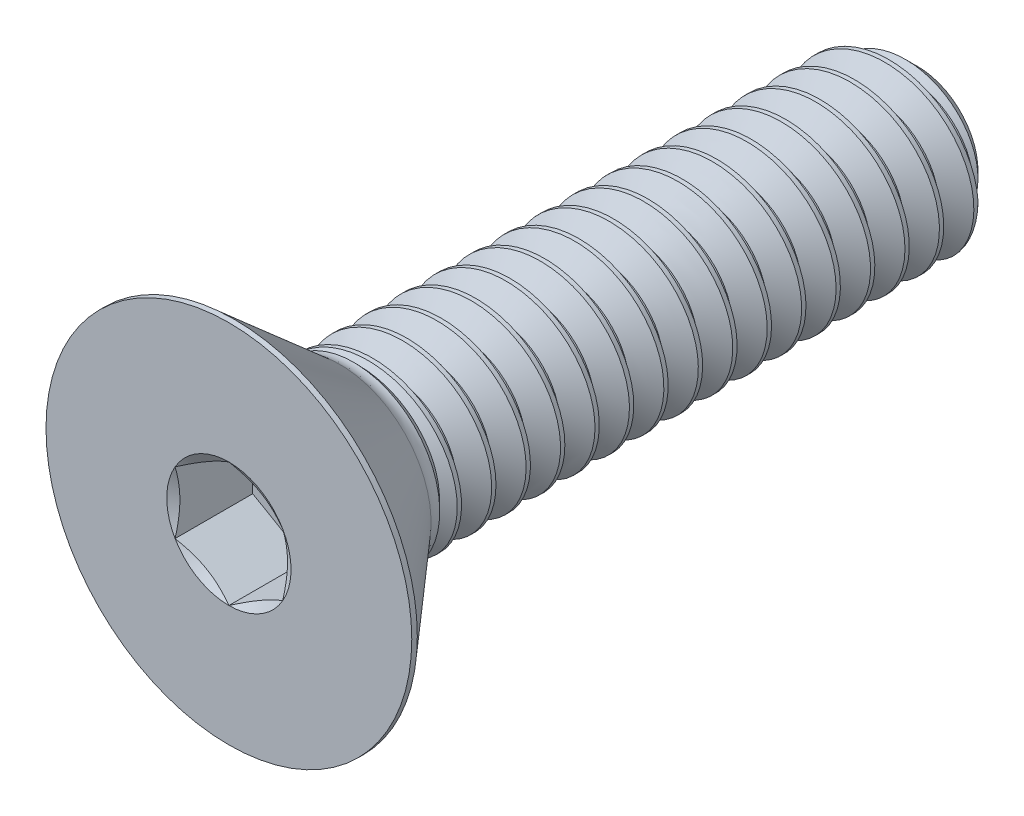
from build123d import *

# Parameters (mm, degrees)
SKETCH1_W          = 25.4
SKETCH1_H          = 3.175
CHAMFER1_SIZE      = 0.9525
CUT_SWEEP1_PITCH   = 1.27
CUT_EXTRUDE2_DEPTH = 2.86258


with BuildPart() as part:
    # Sketch1 → Revolve1 (revolve)
    with BuildSketch(Plane(origin=(0, 0, 0), x_dir=(0, 0, -1), z_dir=(1, 0, 0))):
        with Locations((12.7, 1.5875)):
            Rectangle(SKETCH1_W, SKETCH1_H)
    revolve(axis=Axis((0, 0, -25.4), (0, 0, 1)))

    # Chamfer1
    chamfer1_edges = [part.edges().sort_by_distance(p)[0] for p in [
        (0, -3.175, -25.4),
    ]]
    chamfer(chamfer1_edges, length=CHAMFER1_SIZE)

    # Cut-Sweep1: the profile of Sketch2 profile screwed along a right-hand helix of 20 turns, 8 arcs to a turn; built about Z, then put on its axis
    cut_sweep1_z = Axis((0, 0, 0), (0, 0, 1))
    cut_sweep1_corners = [(3.1756, 0, 0.00034641), (3.1756, 0, -1.11159641), (2.350110803, 0, -0.635), (2.350110803, 0, -0.47625)]
    with BuildLine(mode=Mode.PRIVATE) as cut_sweep1_profile:
        Line(cut_sweep1_corners[0], cut_sweep1_corners[1])
        Line(cut_sweep1_corners[1], cut_sweep1_corners[2])
        Line(cut_sweep1_corners[2], cut_sweep1_corners[3])
        Line(cut_sweep1_corners[3], cut_sweep1_corners[0])
    cut_sweep1_cap = Face(cut_sweep1_profile.wire())
    cut_sweep1_turn_angles = [0, 22.5, 45, 67.5, 90, 112.5, 135, 157.5, 180, 202.5, 225, 247.5, 270, 292.5, 315, 337.5, 360]
    cut_sweep1_turn_weights = [1, 0.9238795325112867, 1, 0.9238795325112867, 1, 0.9238795325112867, 1, 0.9238795325112867, 1, 0.9238795325112867, 1, 0.9238795325112867, 1, 0.9238795325112867, 1, 0.9238795325112867, 1]
    cut_sweep1_turn_rails = [Edge.make_bspline([Vector(p[0], p[1], 0).rotate(cut_sweep1_z, cut_sweep1_turn_angles[k]) / cut_sweep1_turn_weights[k] + Vector(0, 0, p[2] + CUT_SWEEP1_PITCH * cut_sweep1_turn_angles[k] / 360) for k in range(17)], [0, 0, 0, 1, 1, 2, 2, 3, 3, 4, 4, 5, 5, 6, 6, 7, 7, 8, 8, 8], 2, cut_sweep1_turn_weights) for p in cut_sweep1_corners]
    cut_sweep1_turn_sides = [Face.make_surface_from_curves(cut_sweep1_turn_rails[p[0]], cut_sweep1_turn_rails[p[1]]) for p in [(0, 1), (1, 2), (2, 3), (3, 0)]]
    cut_sweep1 = Plane(origin=(0, 0, -25.4), x_dir=(0, 1, 0), z_dir=(0, 0, 1)) * Solid(Shell([*[p.moved(Location((0, 0, CUT_SWEEP1_PITCH * i))) for i in range(20) for p in cut_sweep1_turn_sides], cut_sweep1_cap, cut_sweep1_cap.rotate(cut_sweep1_z, 7200).moved(Location((0, 0, CUT_SWEEP1_PITCH * 7200 / 360)))]))
    add(cut_sweep1, mode=Mode.SUBTRACT)

    # Sketch7 → Revolve2 (revolve)
    with BuildSketch(Plane(origin=(0, 0, 0), x_dir=(0, 0, -1), z_dir=(1, 0, 0)), mode=Mode.PRIVATE) as revolve2_sk:
        with BuildLine():
            Line((0, 6.7437), (0.20447, 6.7437))
            Line((0.20447, 6.7437), (4.0894, 3.366581874))
            ThreePointArc((4.0894, 3.366581874), (4.328282675, 3.224461616), (4.601808997, 3.175))
            Line((4.601808997, 3.175), (4.601808997, 0))
            Line((4.601808997, 0), (0, 0))
            Line((0, 0), (0, 6.7437))
        make_face()
    revolve(revolve2_sk.sketch.rotate(Axis((0, 0, 0), (0, 0, -1)), 189.052465709), axis=Axis((0, 0, 0), (0, 0, -1)))

    # Boss-Extrude1 cone 1 section (through the dimple's axis) → Boss-Extrude1 (revolve)
    with BuildSketch(Plane(origin=(0, 0, -4.601808997), x_dir=(0, -1, 0), z_dir=(1, 0, 0))):
        Polygon((0, 0), (3.175, 0), (0, 3.06606186), align=None)
    revolve(axis=Axis((0, 0, -4.601808997), (0, 0, -1)))

    # Sketch5 → Cut-Extrude2 (cut)
    with BuildSketch(Plane.XY):
        Polygon((0, 2.291358881), (-1.984375, 1.14567944), (-1.984375, -1.14567944), (0, -2.291358881), (1.984375, -1.14567944), (1.984375, 1.14567944), align=None)
    extrude(amount=-CUT_EXTRUDE2_DEPTH, mode=Mode.SUBTRACT)

    # Cut-Extrude3 cone 1 section (through the dimple's axis) → Cut-Extrude3 (revolve, cut)
    with BuildSketch(Plane(origin=(0, 0, 0), x_dir=(0, -1, 0), z_dir=(1, 0, 0))):
        Polygon((0, 0), (2.291358881, 0), (0, 1.322916667), align=None)
    revolve(axis=Axis((0, 0, 0), (0, 0, -1)), mode=Mode.SUBTRACT)


solid = part.part
